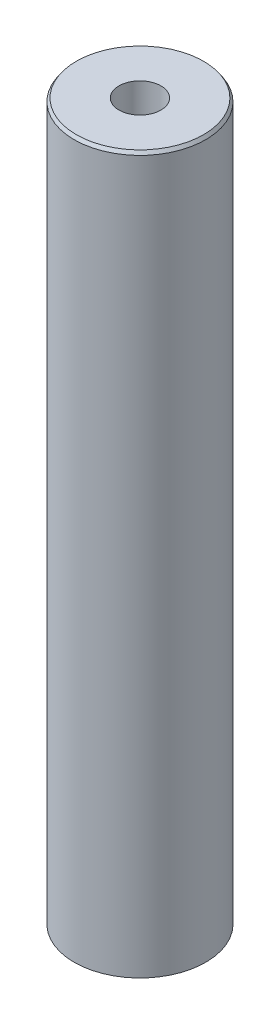
from build123d import *
from OCP.BRepFilletAPI import BRepFilletAPI_MakeChamfer

# Parameters (mm, degrees)
SKETCH1_R           = 55
BOSS_EXTRUDE1_DEPTH = 600
SKETCH2_R           = 17.549236962
CUT_EXTRUDE1_DEPTH  = 606.020660804
CHAMFER1_SIZE       = 2.708779395
CHAMFER1_SIZE2      = 1.806652862


with BuildPart() as part:
    # Sketch1 → Boss-Extrude1 (new body)
    with BuildSketch(Plane(origin=(0, 0, 0), x_dir=(1, 0, 0), z_dir=(0, 1, 0))):
        Circle(SKETCH1_R)
    extrude(amount=BOSS_EXTRUDE1_DEPTH)

    # Sketch2 → Cut-Extrude1 (cut, through all)
    with BuildSketch(Plane(origin=(0, 0, 0), x_dir=(1, 0, 0), z_dir=(0, 1, 0))):
        Circle(SKETCH2_R)
    extrude(amount=CUT_EXTRUDE1_DEPTH, mode=Mode.SUBTRACT)

    # Chamfer1: one chamfer whose edges measure the first distance from different faces: ONE call of the kernel's chamfer builder (chamfer() names one face for all edges)
    chamfer1_edges_1 = [part.edges().sort_by_distance(p)[0] for p in [
        (-55, 600, 0),
    ]]
    chamfer1_side_1 = [part.faces().sort_by_distance(p)[0] for p in [
        (-55, 300, 0),
    ]]
    chamfer1_edges_2 = [part.edges().sort_by_distance(p)[0] for p in [
        (-55, 0, 0),
    ]]
    chamfer1_side_2 = [part.faces().sort_by_distance(p)[0] for p in [
        (-53.444365081, 0, 0),
    ]]
    chamfer1 = BRepFilletAPI_MakeChamfer(part.part.solid().wrapped)
    for e in chamfer1_edges_1:
        chamfer1.Add(CHAMFER1_SIZE, CHAMFER1_SIZE2, e.wrapped, chamfer1_side_1[0].wrapped)  # the first distance lies on this face
    for e in chamfer1_edges_2:
        chamfer1.Add(CHAMFER1_SIZE, CHAMFER1_SIZE2, e.wrapped, chamfer1_side_2[0].wrapped)  # the first distance lies on this face
    add(Compound.cast(chamfer1.Shape()), mode=Mode.REPLACE)


solid = part.part
